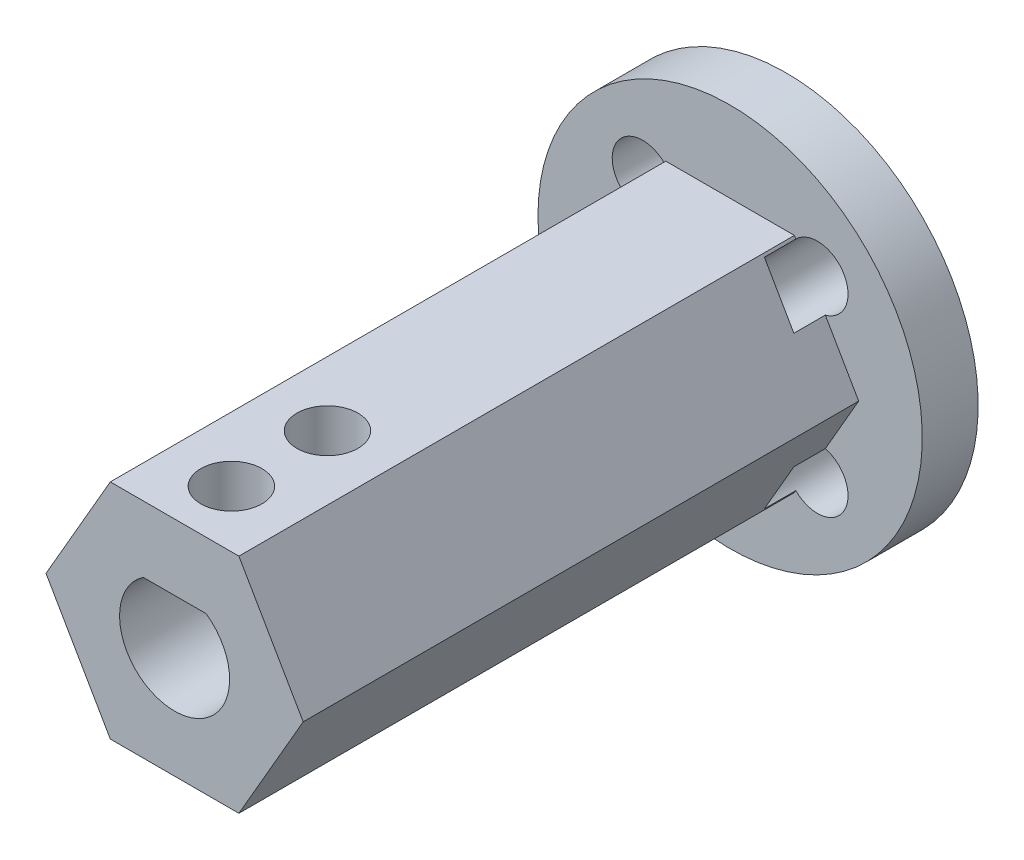
from build123d import *

# Parameters (mm, degrees)
SALIENTE_EXTRUIR1_DEPTH    = 35
CROQUIS2_R                 = 1.75
CORTAR_EXTRUIR1_DEPTH      = 7.5
CROQUIS3_R                 = 11
SALIENTE_EXTRUIR2_DEPTH    = 3.2
CORTAR_EXTRUIR2_DEPTH      = 39.301436004
CORTAR_EXTRUIR2_DEPTH_BACK = 5
CROQUIS5_R                 = 1.75


with BuildPart() as part:
    # Croquis1 → Saliente-Extruir1 (new body)
    with BuildSketch(Plane.XY):
        Polygon((7.361677812, 0), (3.680838906, 6.3754), (-3.680838906, 6.3754), (-7.361677812, 0), (-3.680838906, -6.3754), (3.680838906, -6.3754), align=None)
        with BuildLine():
            Line((-1.8, 2.585053191), (1.8, 2.585053191))
            ThreePointArc((1.8, 2.585053191), (0, -3.15), (-1.8, 2.585053191))
        make_face(mode=Mode.SUBTRACT)
    extrude(amount=SALIENTE_EXTRUIR1_DEPTH)

    # Croquis2 → Cortar-Extruir1 (cut)
    with BuildSketch(Plane(origin=(0, 6.3754, 0), x_dir=(1, 0, 0), z_dir=(0, 1, 0))):
        with Locations((0, -31.75)):
            Circle(CROQUIS2_R)
        with Locations((0, -26.25)):
            Circle(CROQUIS2_R)
    extrude(amount=-CORTAR_EXTRUIR1_DEPTH, mode=Mode.SUBTRACT)

    # Croquis3 → Saliente-Extruir2 (add)
    with BuildSketch(Plane(origin=(0, 0, 0), x_dir=(-1, 0, 0), z_dir=(0, 0, -1))):
        Circle(CROQUIS3_R)
    extrude(amount=-SALIENTE_EXTRUIR2_DEPTH)

    # Croquis5 → Cortar-Extruir2 (cut, two sides: drawn at the far end of the back side and taken through both)
    with BuildSketch(Plane(origin=(0, 0, 0), x_dir=(-1, 0, 0), z_dir=(0, 0, -1)).offset(-CORTAR_EXTRUIR2_DEPTH_BACK)):
        with Locations((-5, 5)):
            Circle(CROQUIS5_R)
        with Locations((5, 5)):
            Circle(CROQUIS5_R)
        with Locations((5, -5)):
            Circle(CROQUIS5_R)
        with Locations((-5, -5)):
            Circle(CROQUIS5_R)
    extrude(amount=CORTAR_EXTRUIR2_DEPTH + CORTAR_EXTRUIR2_DEPTH_BACK, mode=Mode.SUBTRACT)


solid = part.part
